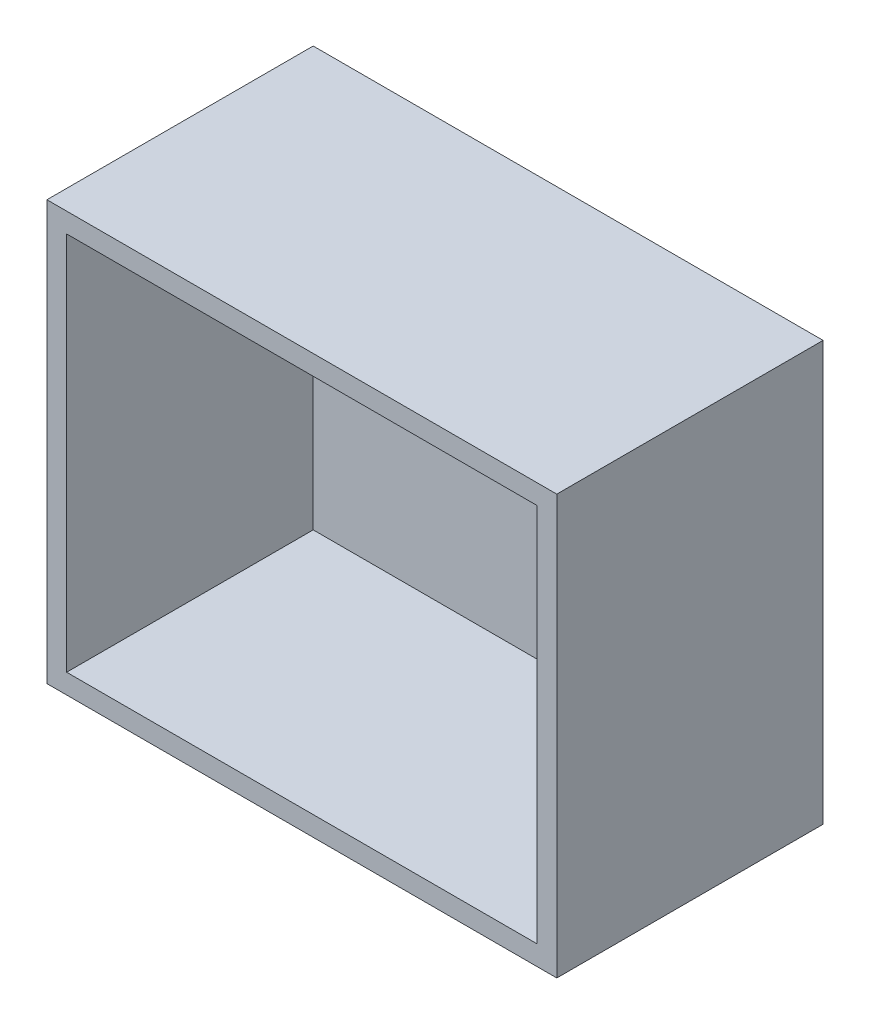
from build123d import *

# Parameters (mm, degrees)
SHEET_EXTRUDE_1_2_DEPTH = 50
SKETCH_1_2_W            = 97.399040294
SKETCH_1_2_H            = 78.98176722
THICKEN_1_T1            = 2
SHELL_START             = -3.0000001
SHELL_1_OUTLINE_W       = 103.399040294
SHELL_1_OUTLINE_H       = 84.98176722
SHELL_1_OUTLINE_W_2     = 95.399040294
SHELL_1_OUTLINE_H_2     = 76.98176722
SHELL_1_DEPTH           = 54.0000001
SHELL_1_2_OUTLINE_W     = 95.399040294
SHELL_1_2_OUTLINE_H     = 76.98176722
SHELL_1_2_DEPTH         = 4.0000001
SHELL_START_2           = -44.324310237
SHELL_1_3_DEPTH         = 101.399040294
SHELL_1_4_OUTLINE_W     = 78.98176722
SHELL_1_4_OUTLINE_H     = 50
SHELL_1_4_DEPTH         = 2
SHELL_START_3           = 55.074730057
SHELL_1_5_OUTLINE_W     = 78.98176722
SHELL_1_5_OUTLINE_H     = 50
SHELL_1_5_DEPTH         = 2


with BuildPart() as body_1:
    # Sheet Extrude 1: a surface, the sketch's curves swept straight by 50 mm
    with BuildLine(Plane.XY, mode=Mode.PRIVATE) as sheet_extrude_1_2_path:
        Line((-42.324310237, 40.376329431), (55.074730057, 40.376329431))
        Line((55.074730057, 40.376329431), (55.074730057, -38.605437789))
        Line((55.074730057, -38.605437789), (-42.324310237, -38.605437789))
        Line((-42.324310237, -38.605437789), (-42.324310237, 40.376329431))
    sheet_extrude_1_2 = Shell.extrude(sheet_extrude_1_2_path.wire(), (0 * SHEET_EXTRUDE_1_2_DEPTH, 0 * SHEET_EXTRUDE_1_2_DEPTH, 1 * SHEET_EXTRUDE_1_2_DEPTH))
    # Эскиз1<2> → Sheet Fill 1: a flat surface bounded by the sketch
    with BuildSketch(Plane.XY, mode=Mode.PRIVATE) as sheet_fill_1_3_region:
        with Locations((6.37520991, 0.885445821)):
            Rectangle(SKETCH_1_2_W, SKETCH_1_2_H)
    sheet_fill_1_3 = sheet_fill_1_3_region.sketch.faces()[0]
    # Knit 1: the surfaces knitted into one
    knit_1_1 = Shell(Face.sew_faces(sheet_extrude_1_2.faces() + sheet_fill_1_3.faces())[0])
    add(Solid.thicken(knit_1_1, THICKEN_1_T1))

    # Оболочка1: read off the stored shape, not the designer's step
    # Оболочка1 outline → Оболочка1 (add)
    with BuildSketch(Plane.XY.offset(SHELL_START)):
        with Locations((6.37520991, 0.885445821)):
            Rectangle(SHELL_1_OUTLINE_W, SHELL_1_OUTLINE_H)
        with Locations((6.37520991, 0.885445821)):
            Rectangle(SHELL_1_OUTLINE_W_2, SHELL_1_OUTLINE_H_2, mode=Mode.SUBTRACT)
    extrude(amount=SHELL_1_DEPTH)

    # Shell 1 2 outline → Shell 1 2 (add)
    with BuildSketch(Plane.XY.offset(SHELL_START)):
        with Locations((6.37520991, 0.885445821)):
            Rectangle(SHELL_1_2_OUTLINE_W, SHELL_1_2_OUTLINE_H)
    extrude(amount=SHELL_1_2_DEPTH)

    # Shell 1 3 outline → Shell 1 3 (cut)
    with BuildSketch(Plane.YZ.offset(SHELL_START_2)):
        with BuildLine():
            add(Edge.make_bspline(
                [(42.376329431, -2), (-40.605437789, -2)],
                knots=[-0.0253223, -0.0253223, 1.0253223, 1.0253223], degree=1))
            Line((42.376329431, -2), (42.376329431, 50))
            Line((42.376329431, 50), (40.376329431, 50))
            Line((40.376329431, 50), (40.376329431, 0))
            Line((40.376329431, 0), (-38.605437789, 0))
            Line((-38.605437789, 0), (-38.605437789, 50))
            Line((-38.605437789, 50), (-40.605437789, 50))
            Line((-40.605437789, 50), (-40.605437789, -2))
        make_face()
    extrude(amount=SHELL_1_3_DEPTH, mode=Mode.SUBTRACT)

    # Shell 1 4 outline → Shell 1 4 (cut)
    with BuildSketch(Plane.YZ.offset(SHELL_START_2)):
        with Locations((0.885445821, 25)):
            Rectangle(SHELL_1_4_OUTLINE_W, SHELL_1_4_OUTLINE_H)
    extrude(amount=SHELL_1_4_DEPTH, mode=Mode.SUBTRACT)

    # Shell 1 5 outline → Shell 1 5 (cut)
    with BuildSketch(Plane.YZ.offset(SHELL_START_3)):
        with Locations((0.885445821, 25)):
            Rectangle(SHELL_1_5_OUTLINE_W, SHELL_1_5_OUTLINE_H)
    extrude(amount=SHELL_1_5_DEPTH, mode=Mode.SUBTRACT)


solid = body_1.part
